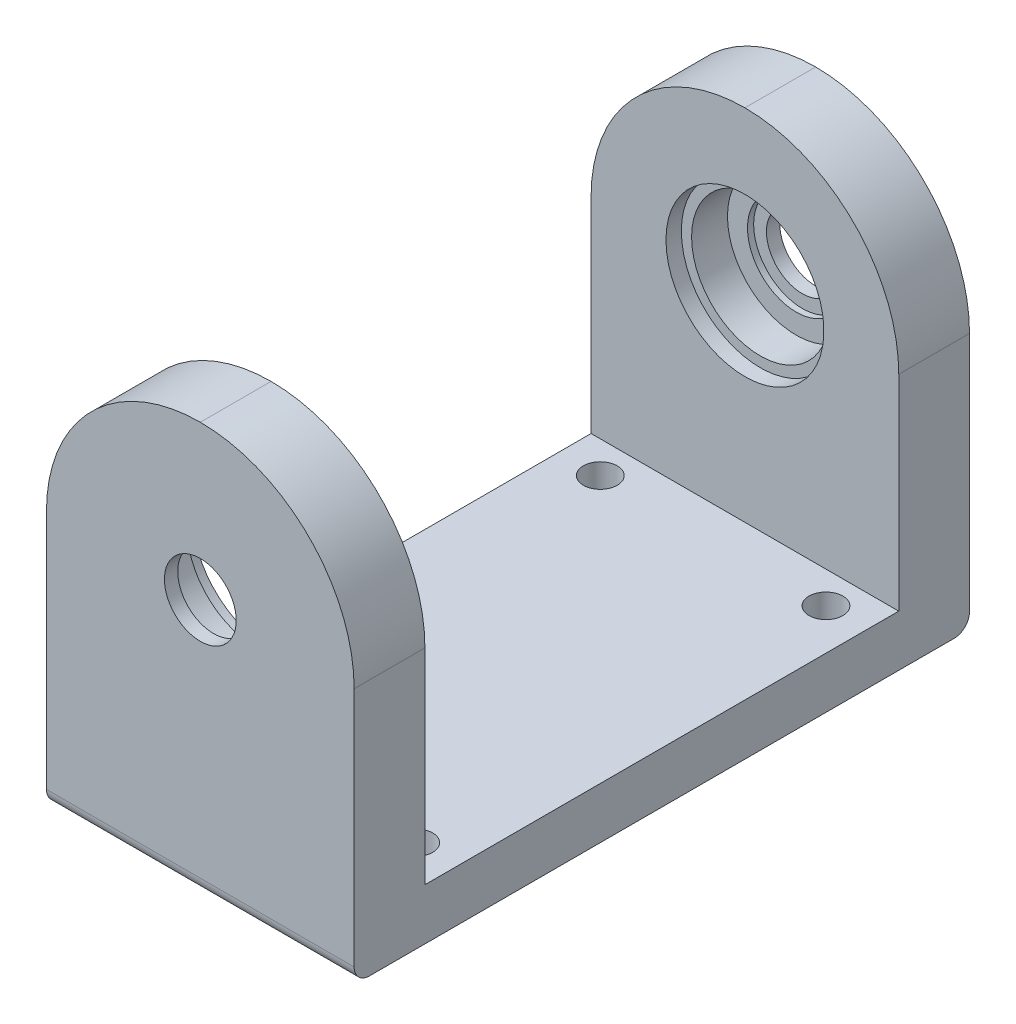
from build123d import *

# Parameters (mm, degrees)
SKETCH1_W           = 30
SKETCH1_H           = 60
BOSS_EXTRUDE1_DEPTH = 5
SKETCH3_R           = 3.5
BOSS_EXTRUDE2_DEPTH = 6.9
SKETCH4_R           = 7.7
CUT_EXTRUDE1_DEPTH  = 1.5
SKETCH6_R           = 6.7
CUT_EXTRUDE2_DEPTH  = 3.5
SKETCH9_R           = 4.75
CUT_EXTRUDE4_DEPTH  = 0.6
FILLET1_R           = 15
SKETCH15_R          = 1.65
CUT_EXTRUDE5_DEPTH  = 10
SKETCH16_W          = 15
SKETCH16_H          = 6.25
BOSS_EXTRUDE3_DEPTH = 5
FILLET2_R           = 1.5
FILLET3_R           = 1


with BuildPart() as part:
    # Sketch1 → Boss-Extrude1 (new body)
    with BuildSketch(Plane(origin=(0, 0, 0), x_dir=(1, 0, 0), z_dir=(0, 1, 0))):
        Rectangle(SKETCH1_W, SKETCH1_H)
    extrude(amount=BOSS_EXTRUDE1_DEPTH)

    # Sketch3 → Boss-Extrude2 (add)
    with BuildSketch(Plane.XY.offset(30)):
        Polygon((-15, 5), (15, 5), (15, 25), (15, 40), (-15, 40), (-15, 25), align=None)
        with Locations((0, 25)):
            Circle(SKETCH3_R, mode=Mode.SUBTRACT)
    boss_extrude2 = extrude(amount=-BOSS_EXTRUDE2_DEPTH)

    # Sketch4 → Cut-Extrude1 (cut)
    with BuildSketch(Plane(origin=(0, 0, 23.1), x_dir=(-1, 0, 0), z_dir=(0, 0, -1))):
        with Locations((0, 25)):
            Circle(SKETCH4_R)
    cut_extrude1 = extrude(amount=-CUT_EXTRUDE1_DEPTH, mode=Mode.SUBTRACT)

    # Sketch6 → Cut-Extrude2 (cut)
    with BuildSketch(Plane(origin=(0, 0, 24.6), x_dir=(-1, 0, 0), z_dir=(0, 0, -1))):
        with Locations((0, 25)):
            Circle(SKETCH6_R)
    cut_extrude2 = extrude(amount=-CUT_EXTRUDE2_DEPTH, mode=Mode.SUBTRACT)

    # Sketch9 → Cut-Extrude4 (cut)
    with BuildSketch(Plane(origin=(0, 0, 28.1), x_dir=(-1, 0, 0), z_dir=(0, 0, -1))):
        with Locations((0, 25)):
            Circle(SKETCH9_R)
    cut_extrude4 = extrude(amount=-CUT_EXTRUDE4_DEPTH, mode=Mode.SUBTRACT)

    # Mirror2: Boss-Extrude2, Cut-Extrude1, Cut-Extrude2, Cut-Extrude4 across plane
    add(boss_extrude2.mirror(Plane.XY))
    add(cut_extrude1.mirror(Plane.XY), mode=Mode.SUBTRACT)
    add(cut_extrude2.mirror(Plane.XY), mode=Mode.SUBTRACT)
    add(cut_extrude4.mirror(Plane.XY), mode=Mode.SUBTRACT)

    # Fillet1
    fillet1_edges = [part.edges().sort_by_distance(p)[0] for p in [
        (-15, 40, -26.55),
        (15, 40, -26.55),
        (-15, 40, 26.55),
        (15, 40, 26.55),
    ]]
    fillet(fillet1_edges, radius=FILLET1_R - 0.0001)  # a hair under: the kernel refuses the full size

    # Sketch15 → Cut-Extrude5 (cut)
    with BuildSketch(Plane(origin=(0, 5, 0), x_dir=(1, 0, 0), z_dir=(0, 1, 0))):
        with Locations(Location((-11, -20, 0), (0, 0, 270))):
            Circle(SKETCH15_R)
        with Locations(Location((11, -20, 0), (0, 0, 270))):
            Circle(SKETCH15_R)
        with Locations(Location((-11, 20, 0), (0, 0, 270))):
            Circle(SKETCH15_R)
        with Locations(Location((11, 20, 0), (0, 0, 270))):
            Circle(SKETCH15_R)
    extrude(amount=-CUT_EXTRUDE5_DEPTH, mode=Mode.SUBTRACT)

    # Sketch16 → Boss-Extrude3 (add)
    with BuildSketch(Plane.XZ):
        with Locations((0, 20)):
            Rectangle(SKETCH16_W, SKETCH16_H)
        with Locations((0, -20)):
            Rectangle(SKETCH16_W, SKETCH16_H)
    extrude(amount=BOSS_EXTRUDE3_DEPTH)

    # Fillet2
    fillet2_edges = [part.edges().sort_by_distance(p)[0] for p in [
        (0, 0, -30),
        (0, 0, 30),
    ]]
    fillet(fillet2_edges, radius=FILLET2_R)

    # Fillet3
    fillet3_edges = [part.edges().sort_by_distance(p)[0] for p in [
        (0, -5, 23.125),
        (0, -5, 16.875),
        (0, -5, -16.875),
        (0, -5, -23.125),
    ]]
    fillet(fillet3_edges, radius=FILLET3_R)


solid = part.part
